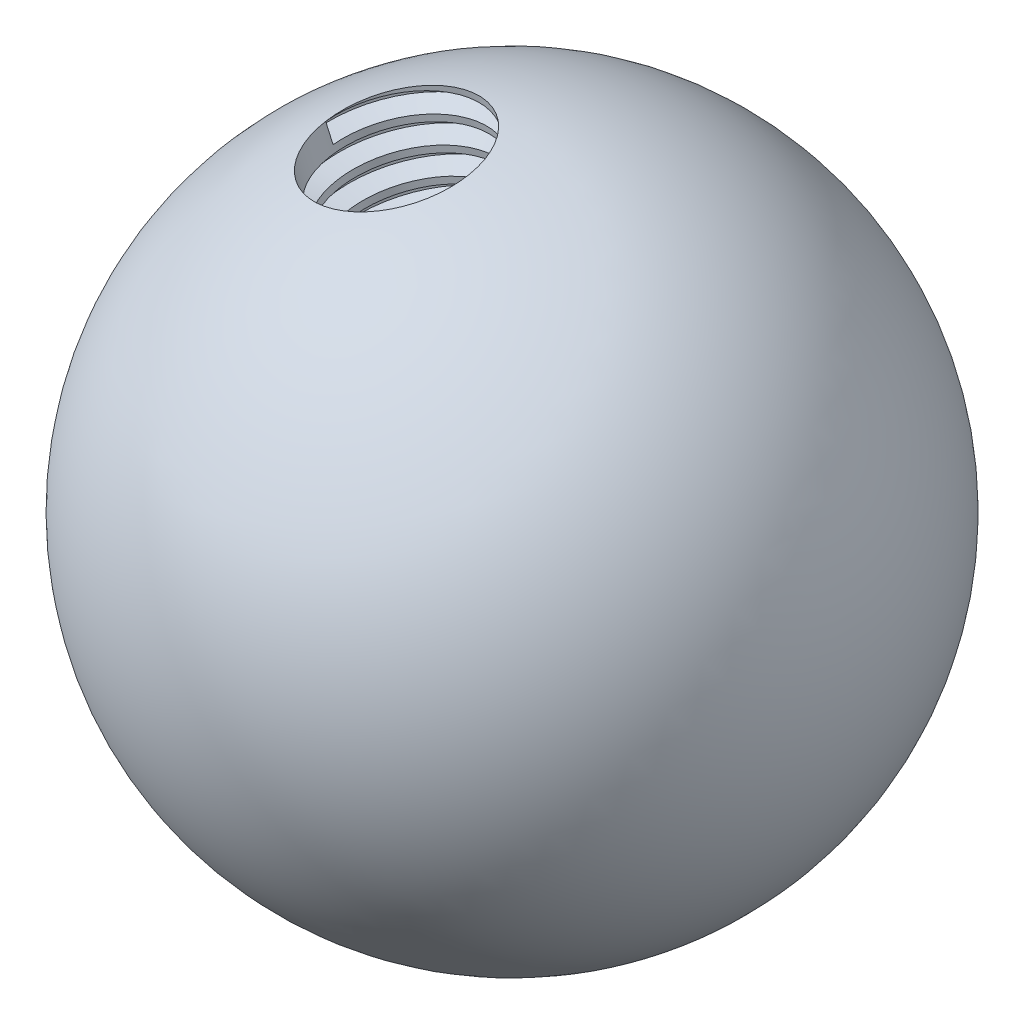
from build123d import *

# Parameters (mm, degrees)
FILETTATURA1_PITCH = 1.25


with BuildPart() as part:
    # Schizzo1 → Rivoluzione1 (revolve)
    with BuildSketch(Plane.XY):
        with BuildLine():
            Line((0.663556424, 14.985315908), (-0.663556424, -14.985315908))
            ThreePointArc((-0.663556424, -14.985315908), (-14.985315908, 0.663556424), (0.663556424, 14.985315908))
        make_face()
    revolve(axis=Axis((0.663556424, 14.985315908, 0), (-0.044237094932313946, -0.999021060554756, 0)))

    # Schizzo2 → Preforo da maschiare M8x1.25-1 (revolve, cut)
    with BuildSketch(Plane(origin=(-2.901516903, 14.502881143, 2.499527597), x_dir=(-0.680275757507728, -0.2545587908916996, 0.6873315908111914), z_dir=(0.7069710060228755, 0.019595746630497193, 0.7069710060228757))):
        Polygon((0, 0), (0, 16.5), (3.4, 14.457073895), (3.4, 0), align=None)
    revolve(axis=Axis((-4.129825725, 20.642434161, 3.557660946), (0.1934344601933443, -0.9668587428853035, -0.16663517310568068)), mode=Mode.SUBTRACT)

    # Filettatura1: the profile of Profilo filettatura1 profile screwed along a right-hand helix of 12 turns, 8 arcs to a turn; built about Z, then put on its axis
    filettatura1_z = Axis((0, 0, 0), (0, 0, 1))
    filettatura1_corners = [(3.3997, -1e-09, -0.000173204), (4.076582344, -1e-09, 0.390624999), (4.076582344, -1e-09, 0.546874999), (3.3997, -1e-09, 0.937673203)]
    with BuildLine(mode=Mode.PRIVATE) as filettatura1_profile:
        Line(filettatura1_corners[0], filettatura1_corners[1])
        Line(filettatura1_corners[1], filettatura1_corners[2])
        Line(filettatura1_corners[2], filettatura1_corners[3])
        Line(filettatura1_corners[3], filettatura1_corners[0])
    filettatura1_cap = Face(filettatura1_profile.wire())
    filettatura1_turn_angles = [0, 22.5, 45, 67.5, 90, 112.5, 135, 157.5, 180, 202.5, 225, 247.5, 270, 292.5, 315, 337.5, 360]
    filettatura1_turn_weights = [1, 0.9238795325112867, 1, 0.9238795325112867, 1, 0.9238795325112867, 1, 0.9238795325112867, 1, 0.9238795325112867, 1, 0.9238795325112867, 1, 0.9238795325112867, 1, 0.9238795325112867, 1]
    filettatura1_turn_rails = [Edge.make_bspline([Vector(p[0], p[1], 0).rotate(filettatura1_z, filettatura1_turn_angles[k]) / filettatura1_turn_weights[k] + Vector(0, 0, p[2] + FILETTATURA1_PITCH * filettatura1_turn_angles[k] / 360) for k in range(17)], [0, 0, 0, 1, 1, 2, 2, 3, 3, 4, 4, 5, 5, 6, 6, 7, 7, 8, 8, 8], 2, filettatura1_turn_weights) for p in filettatura1_corners]
    filettatura1_turn_sides = [Face.make_surface_from_curves(filettatura1_turn_rails[p[0]], filettatura1_turn_rails[p[1]]) for p in [(0, 1), (1, 2), (2, 3), (3, 0)]]
    filettatura1 = Plane(origin=(-2.825997361, 14.125405852, 2.434470874), x_dir=(-0.981113199, -0.190624078, -0.032853482), z_dir=(0.19343446, -0.966858743, -0.166635173)) * Solid(Shell([*[p.moved(Location((0, 0, FILETTATURA1_PITCH * i))) for i in range(12) for p in filettatura1_turn_sides], filettatura1_cap, filettatura1_cap.rotate(filettatura1_z, 4320).moved(Location((0, 0, FILETTATURA1_PITCH * 4320 / 360)))]))
    add(filettatura1, mode=Mode.SUBTRACT)


solid = part.part
